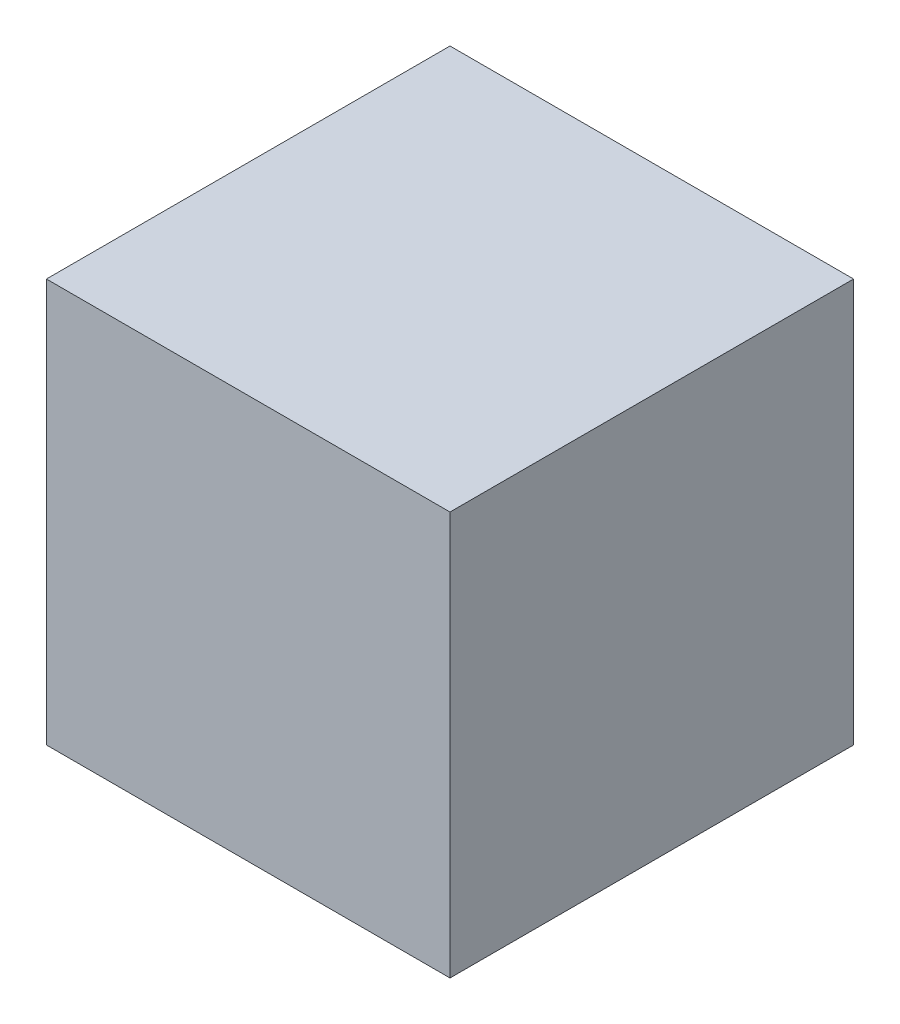
from build123d import *

# Parameters (mm, degrees)
BOSS_EXTRUDE1_DEPTH      = 30
BOSS_EXTRUDE1_DEPTH_BACK = 30
SKETCH1_W                = 60
SKETCH1_H                = 60


with BuildPart() as part:
    # Sketch1 → Boss-Extrude1 (new, two sides: drawn at the far end of the back side and taken through both)
    with BuildSketch(Plane(origin=(0, 0, 0), x_dir=(1, 0, 0), z_dir=(0, 1, 0)).offset(-BOSS_EXTRUDE1_DEPTH_BACK)):
        Rectangle(SKETCH1_W, SKETCH1_H)
    extrude(amount=BOSS_EXTRUDE1_DEPTH + BOSS_EXTRUDE1_DEPTH_BACK)


solid = part.part
